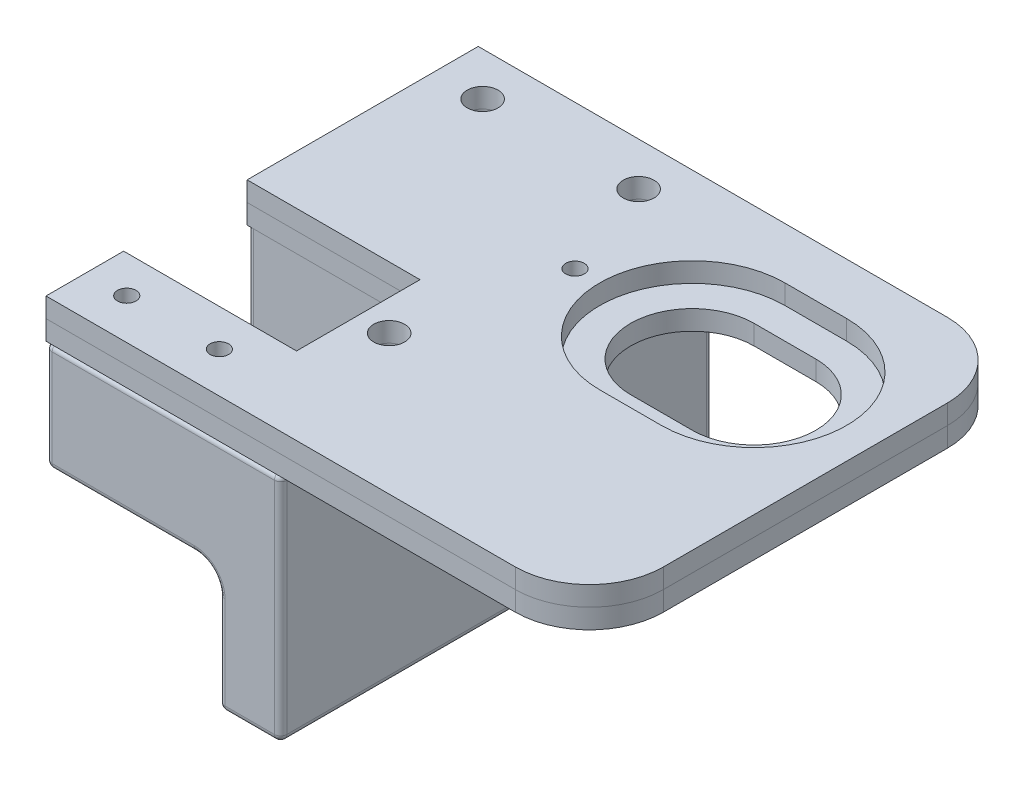
from build123d import *

# Parameters (mm, degrees)
BOSS_EXTRUDE1_DEPTH = 70
SKETCH5_W           = 28
SKETCH5_H           = 20
CUT_EXTRUDE2_DEPTH  = 20
CUT_EXTRUDE10_DEPTH = 121.747670785
CUT_EXTRUDE11_DEPTH = 3.175
SKETCH2_R           = 1.5
CUT_EXTRUDE1_DEPTH  = 115.978258814
SKETCH23_R          = 3.25
CUT_EXTRUDE12_DEPTH = 10
SKETCH24_R          = 2.5
SKETCH24_R_2        = 1.5
CUT_EXTRUDE13_DEPTH = 119.581290683
VARFILLET1_DEPTH    = 70
FILLET1_R           = 12
FILLET3_R           = 1
SKETCH27_R          = 2
CUT_EXTRUDE14_DEPTH = 10


with BuildPart() as part:
    # Sketch1 → Boss-Extrude1 (new body)
    with BuildSketch(Plane.XY):
        Polygon((0, 0), (0, 24), (38, 24), (88, 24), (88, 17.65), (38, 17.65), (38, 0), (38, -20), (28, -20), (28, 0), align=None)
    extrude(amount=BOSS_EXTRUDE1_DEPTH)

    # Sketch5 → Cut-Extrude2 (cut)
    with BuildSketch(Plane(origin=(0, 24, 0), x_dir=(1, 0, 0), z_dir=(0, 1, 0))):
        with Locations((14, -47.426593036)):
            Rectangle(SKETCH5_W, SKETCH5_H)
    extrude(amount=-CUT_EXTRUDE2_DEPTH, mode=Mode.SUBTRACT)

    # Sketch21 → Cut-Extrude10 (cut, through all)
    with BuildSketch(Plane(origin=(0, 24, 0), x_dir=(1, 0, 0), z_dir=(0, 1, 0))):
        with BuildLine():
            Line((58, -13.326593036), (68, -13.326593036))
            ThreePointArc((68, -13.326593036), (78, -23.326593036), (68, -33.326593036))
            Line((68, -33.326593036), (58, -33.326593036))
            ThreePointArc((58, -33.326593036), (48, -23.326593036), (58, -13.326593036))
        make_face()
    extrude(amount=-CUT_EXTRUDE10_DEPTH, mode=Mode.SUBTRACT)

    # Sketch22 → Cut-Extrude11 (cut)
    with BuildSketch(Plane(origin=(0, 24, 0), x_dir=(1, 0, 0), z_dir=(0, 1, 0))):
        with BuildLine():
            Line((58, -8.326593036), (68, -8.326593036))
            ThreePointArc((68, -8.326593036), (83, -23.326593036), (68, -38.326593036))
            Line((68, -38.326593036), (58, -38.326593036))
            ThreePointArc((58, -38.326593036), (43, -23.326593036), (58, -8.326593036))
        make_face()
    extrude(amount=-CUT_EXTRUDE11_DEPTH, mode=Mode.SUBTRACT)

    # Sketch2 → Cut-Extrude1 (cut, through all)
    with BuildSketch(Plane(origin=(0, 0, 0), x_dir=(1, 0, 0), z_dir=(0, 1, 0))):
        with Locations(Location((6.5, -47.426593036, 0), (0, 0, 180))):
            Circle(SKETCH2_R)
        with Locations(Location((6.5, -63.426593036, 0), (0, 0, 270))):
            Circle(SKETCH2_R)
        with Locations(Location((21.5, -63.426593036, 0), (0, 0, 270))):
            Circle(SKETCH2_R)
        with Locations(Location((21.5, -47.426593036, 0), (0, 0, 180))):
            Circle(SKETCH2_R)
    extrude(amount=CUT_EXTRUDE1_DEPTH, mode=Mode.SUBTRACT)


with BuildPart() as body_2:
    # Split1: read off the stored shape, not the designer's step
    # Split1: the piece on the far side of the plane
    add(part.part)
    split(bisect_by=Plane(origin=(0, 17.65, 0), x_dir=(1, 0, 0), z_dir=(0, 1, 0)), keep=Keep.BOTTOM)

    # Sketch23 → Cut-Extrude12 (cut)
    with BuildSketch(Plane(origin=(0, 17.65, 0), x_dir=(1, 0, 0), z_dir=(0, 1, 0))):
        with Locations(Location((33, -47.426593036, 0), (0, 0, 270))):
            Circle(SKETCH23_R)
        with Locations(Location((7.728374454, -7.021494916, 0), (0, 0, 270))):
            Circle(SKETCH23_R)
        with Locations(Location((33, -7.021494916, 0), (0, 0, 270))):
            Circle(SKETCH23_R)
    extrude(amount=-CUT_EXTRUDE12_DEPTH, mode=Mode.SUBTRACT)

    # VarFillet1: read off the stored shape, not the designer's step
    # VarFillet1 outline → VarFillet1 (add)
    with BuildSketch(Plane.XY):
        with BuildLine():
            add(Edge.make_bspline(
                [(28, -4), (28, 0), (24, 0)],
                knots=[0, 0, 0, 1, 1, 1], degree=2, weights=[1, 0.707106781, 1]))
            Line((28, -4), (28, 0))
            Line((28, 0), (24, 0))
        make_face()
    extrude(amount=VARFILLET1_DEPTH)

    # Fillet3
    fillet3_edges = [body_2.edges().sort_by_distance(p)[0] for p in [
        (0, 0, 35),
        (0, 10.825, 37.426593036),
        (0, 17.65, 18.713296518),
        (0, 4, 47.426593036),
        (0, 10.825, 57.426593036),
        (0, 8.825, 70),
        (0, 17.65, 63.713296518),
        (28, -20, 35),
        (38, -20, 35),
        (0, 8.825, 0),
        (12, 0, 0),
        (26.828426796, -1.171572546, 0),
        (28, -12, 0),
        (33, -20, 0),
        (38, -1.175, 0),
        (19, 17.65, 0),
        (38, 17.65, 35),
        (33, -20, 70),
        (28, -12, 70),
        (26.828426796, -1.171572546, 70),
        (12, 0, 70),
        (38, -1.175, 70),
        (19, 17.65, 70),
    ]]
    fillet(fillet3_edges, radius=FILLET3_R)

    # Sketch27 → Cut-Extrude14 (cut)
    with BuildSketch(Plane.XZ.offset(20)):
        with Locations(Location((33, 35, 0), (0, 0, 270))):
            Circle(SKETCH27_R)
    extrude(amount=-CUT_EXTRUDE14_DEPTH, mode=Mode.SUBTRACT)


with BuildPart() as part_1:
    add(part.part)

    # Split1
    split(bisect_by=Plane(origin=(0, 17.65, 0), x_dir=(1, 0, 0), z_dir=(0, 1, 0)), keep=Keep.TOP)

    # Sketch24 → Cut-Extrude13 (cut, through all)
    with BuildSketch(Plane.XZ.offset(-17.65)):
        with Locations(Location((33, 47.426593036, 0), (0, 0, 270))):
            Circle(SKETCH24_R)
        with Locations(Location((7.728374454, 7.021494916, 0), (0, 0, 270))):
            Circle(SKETCH24_R)
        with Locations(Location((39, 23.326593036, 0), (0, 0, 270))):
            Circle(SKETCH24_R_2)
        with Locations(Location((33, 7.021494916, 0), (0, 0, 270))):
            Circle(SKETCH24_R)
    extrude(amount=-CUT_EXTRUDE13_DEPTH, mode=Mode.SUBTRACT)

    # Fillet1
    fillet1_edges = [part_1.edges().sort_by_distance(p)[0] for p in [
        (88, 20.825, 0),
        (88, 20.825, 70),
    ]]
    fillet(fillet1_edges, radius=FILLET1_R)


with BuildPart() as body_3:
    # Split2: read off the stored shape, not the designer's step
    # Split2: the piece on the far side of the plane
    add(part_1.part)
    split(bisect_by=Plane(origin=(0, 20.825, 0), x_dir=(1, 0, 0), z_dir=(0, 1, 0)), keep=Keep.BOTTOM)


with BuildPart() as part_2:
    add(part_1.part)

    # Split2
    split(bisect_by=Plane(origin=(0, 20.825, 0), x_dir=(1, 0, 0), z_dir=(0, 1, 0)), keep=Keep.TOP)


solid = Compound([body_2.part, body_3.part, part_2.part])
